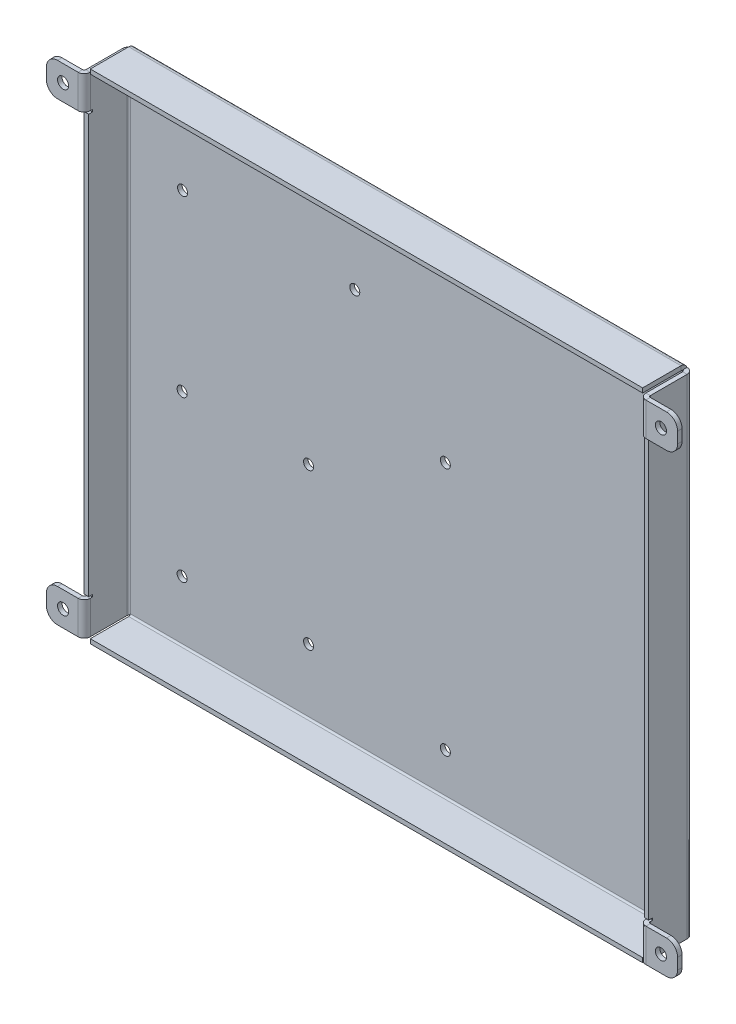
from build123d import *

# Parameters (mm, degrees)
SKETCH1_W                      = 250
SKETCH1_H                      = 220
BASE_FLANGE1_DEPTH             = 2
EDGE_FLANGE1_STRIP_W           = 9.4732
EDGE_FLANGE1_STRIP_H           = 2
EDGE_FLANGE1_STRIP_CUT_DEPTH   = 220
EDGE_FLANGE1_STRIP_2_W         = 9.4732
EDGE_FLANGE1_STRIP_2_H         = 2
EDGE_FLANGE1_STRIP_CUT_2_DEPTH = 220
EDGE_FLANGE1_DEPTH             = 220
EDGE_FLANGE1_BEND_DEPTH        = 220
EDGE_FLANGE2_STRIP_W           = 9.4732
EDGE_FLANGE2_STRIP_H           = 2
EDGE_FLANGE2_STRIP_CUT_DEPTH   = 248.5268
EDGE_FLANGE2_DEPTH             = 248.5268
EDGE_FLANGE3_STRIP_W           = 9.4732
EDGE_FLANGE3_STRIP_H           = 2
EDGE_FLANGE3_STRIP_CUT_DEPTH   = 248.5268
EDGE_FLANGE3_DEPTH             = 248.5268
EDGE_FLANGE4_STRIP_W           = 9.4732
EDGE_FLANGE4_STRIP_H           = 2
EDGE_FLANGE4_STRIP_CUT_DEPTH   = 15
EDGE_FLANGE4_RELIEF_W          = 10.4732
EDGE_FLANGE4_RELIEF_H          = 1
EDGE_FLANGE4_RELIEF_CUT_DEPTH  = 2
EDGE_FLANGE4_DEPTH             = 15
EDGE_FLANGE4_START             = 2
EDGE_FLANGE4_PROFILE_R         = 2.5
EDGE_FLANGE4_FLAT_DEPTH        = 2
EDGE_FLANGE5_STRIP_W           = 9.4732
EDGE_FLANGE5_STRIP_H           = 2
EDGE_FLANGE5_STRIP_CUT_DEPTH   = 15
EDGE_FLANGE5_RELIEF_W          = 10.4732
EDGE_FLANGE5_RELIEF_H          = 1
EDGE_FLANGE5_RELIEF_CUT_DEPTH  = 2
EDGE_FLANGE5_DEPTH             = 15
EDGE_FLANGE5_START             = 2
EDGE_FLANGE5_PROFILE_R         = 2.5
EDGE_FLANGE5_FLAT_DEPTH        = 2
EDGE_FLANGE7_STRIP_W           = 9.4732
EDGE_FLANGE7_STRIP_H           = 2
EDGE_FLANGE7_STRIP_CUT_DEPTH   = 15
EDGE_FLANGE7_RELIEF_W          = 10.4732
EDGE_FLANGE7_RELIEF_H          = 1
EDGE_FLANGE7_RELIEF_CUT_DEPTH  = 2
EDGE_FLANGE7_DEPTH             = 15
EDGE_FLANGE7_START             = 2
EDGE_FLANGE7_PROFILE_R         = 2.5
EDGE_FLANGE7_FLAT_DEPTH        = 2
EDGE_FLANGE8_STRIP_W           = 9.4732
EDGE_FLANGE8_STRIP_H           = 2
EDGE_FLANGE8_STRIP_CUT_DEPTH   = 15
EDGE_FLANGE8_RELIEF_W          = 10.4732
EDGE_FLANGE8_RELIEF_H          = 1
EDGE_FLANGE8_RELIEF_CUT_DEPTH  = 2
EDGE_FLANGE8_DEPTH             = 15
EDGE_FLANGE8_START             = 2
EDGE_FLANGE8_PROFILE_R         = 2.5
EDGE_FLANGE8_FLAT_DEPTH        = 2
SKETCH34_R                     = 2.25
CUT_EXTRUDE1_DEPTH             = 10
SKETCH35_R                     = 2.25
CUT_EXTRUDE2_DEPTH             = 10


# Sheet-metal steps are written as plain solids
with BuildPart() as part:
    # Sketch1 → Base-Flange1 (new body)
    with BuildSketch(Plane.XY):
        Rectangle(SKETCH1_W, SKETCH1_H)
    extrude(amount=-BASE_FLANGE1_DEPTH)

    # Edge-Flange1 strip (across the edge) → Edge-Flange1 strip cut (cut)
    with BuildSketch(Plane(origin=(125, -110, 0), x_dir=(-1, 0, 0), z_dir=(0, 1, 0))):
        with Locations((-4, -1)):
            Rectangle(EDGE_FLANGE1_STRIP_W, EDGE_FLANGE1_STRIP_H)
    extrude(amount=EDGE_FLANGE1_STRIP_CUT_DEPTH, mode=Mode.SUBTRACT)

    # Edge-Flange1 strip 2 (across the edge) → Edge-Flange1 strip cut 2 (cut)
    with BuildSketch(Plane(origin=(-125, 110, 0), x_dir=(1, 0, 0), z_dir=(0, -1, 0))):
        with Locations((-4, -1)):
            Rectangle(EDGE_FLANGE1_STRIP_2_W, EDGE_FLANGE1_STRIP_2_H)
    extrude(amount=EDGE_FLANGE1_STRIP_CUT_2_DEPTH, mode=Mode.SUBTRACT)

    # Edge-Flange1 section (across the edge) → Edge-Flange1 (add)
    with BuildSketch(Plane(origin=(125, -110, 0), x_dir=(-1, 0, 0), z_dir=(0, 1, 0))):
        with BuildLine():
            Line((-2, 0.7366), (-2, 18))
            Line((-2, 18), (0, 18))
            Line((0, 18), (0, 0.7366))
            ThreePointArc((0, 0.7366), (0.215745145, 0.215745145), (0.7366, 0))
            Line((0.7366, 0), (0.7366, -2))
            ThreePointArc((0.7366, -2), (-1.198468417, -1.198468417), (-2, 0.7366))
        make_face()
    extrude(amount=EDGE_FLANGE1_DEPTH)

    # Edge-Flange1 section 2 (across the edge) → Edge-Flange1 bend (add)
    with BuildSketch(Plane(origin=(-125, 110, 0), x_dir=(1, 0, 0), z_dir=(0, -1, 0))):
        with BuildLine():
            Line((-2, 0.7366), (-2, 18))
            Line((-2, 18), (0, 18))
            Line((0, 18), (0, 0.7366))
            ThreePointArc((0, 0.7366), (0.215745145, 0.215745145), (0.7366, 0))
            Line((0.7366, 0), (0.7366, -2))
            ThreePointArc((0.7366, -2), (-1.198468417, -1.198468417), (-2, 0.7366))
        make_face()
    extrude(amount=EDGE_FLANGE1_BEND_DEPTH)

    # Edge-Flange2 strip (across the edge) → Edge-Flange2 strip cut (cut)
    with BuildSketch(Plane(origin=(124.2634, 110, 0), x_dir=(0, -1, 0), z_dir=(-1, 0, 0))):
        with Locations((-4, -1)):
            Rectangle(EDGE_FLANGE2_STRIP_W, EDGE_FLANGE2_STRIP_H)
    extrude(amount=EDGE_FLANGE2_STRIP_CUT_DEPTH, mode=Mode.SUBTRACT)

    # Edge-Flange2 section (across the edge) → Edge-Flange2 (add)
    with BuildSketch(Plane(origin=(124.2634, 110, 0), x_dir=(0, -1, 0), z_dir=(-1, 0, 0))):
        with BuildLine():
            Line((-2, 0.7366), (-2, 18))
            Line((-2, 18), (0, 18))
            Line((0, 18), (0, 0.7366))
            ThreePointArc((0, 0.7366), (0.215745145, 0.215745145), (0.7366, 0))
            Line((0.7366, 0), (0.7366, -2))
            ThreePointArc((0.7366, -2), (-1.198468417, -1.198468417), (-2, 0.7366))
        make_face()
    extrude(amount=EDGE_FLANGE2_DEPTH)

    # Edge-Flange3 strip (across the edge) → Edge-Flange3 strip cut (cut)
    with BuildSketch(Plane(origin=(-124.2634, -110, 0), x_dir=(0, 1, 0), z_dir=(1, 0, 0))):
        with Locations((-4, -1)):
            Rectangle(EDGE_FLANGE3_STRIP_W, EDGE_FLANGE3_STRIP_H)
    extrude(amount=EDGE_FLANGE3_STRIP_CUT_DEPTH, mode=Mode.SUBTRACT)

    # Edge-Flange3 section (across the edge) → Edge-Flange3 (add)
    with BuildSketch(Plane(origin=(-124.2634, -110, 0), x_dir=(0, 1, 0), z_dir=(1, 0, 0))):
        with BuildLine():
            Line((-2, 0.7366), (-2, 18))
            Line((-2, 18), (0, 18))
            Line((0, 18), (0, 0.7366))
            ThreePointArc((0, 0.7366), (0.215745145, 0.215745145), (0.7366, 0))
            Line((0.7366, 0), (0.7366, -2))
            ThreePointArc((0.7366, -2), (-1.198468417, -1.198468417), (-2, 0.7366))
        make_face()
    extrude(amount=EDGE_FLANGE3_DEPTH)

    # Edge-Flange4 strip (across the edge) → Edge-Flange4 strip cut (cut)
    with BuildSketch(Plane(origin=(127, -95, 18), x_dir=(0, 0, -1), z_dir=(0, -1, 0))):
        with Locations((-4, -1)):
            Rectangle(EDGE_FLANGE4_STRIP_W, EDGE_FLANGE4_STRIP_H)
    extrude(amount=EDGE_FLANGE4_STRIP_CUT_DEPTH, mode=Mode.SUBTRACT)

    # Edge-Flange4 relief (on the sheet) → Edge-Flange4 relief cut (cut)
    with BuildSketch(Plane(origin=(127, -95, 17.2634), x_dir=(0, 0, -1), z_dir=(1, 0, 0))):
        with Locations((-4.2366, 0.5)):
            Rectangle(EDGE_FLANGE4_RELIEF_W, EDGE_FLANGE4_RELIEF_H)
    extrude(amount=-EDGE_FLANGE4_RELIEF_CUT_DEPTH, mode=Mode.SUBTRACT)

    # Edge-Flange4 bend section (across the edge) → Edge-Flange4 (add)
    with BuildSketch(Plane(origin=(127, -95, 18), x_dir=(0, 0, -1), z_dir=(0, -1, 0))):
        with BuildLine():
            Line((-2, 0.7366), (0, 0.7366))
            ThreePointArc((0, 0.7366), (0.215745145, 0.215745145), (0.7366, 0))
            Line((0.7366, 0), (0.7366, -2))
            ThreePointArc((0.7366, -2), (-1.198468417, -1.198468417), (-2, 0.7366))
        make_face()
    extrude(amount=EDGE_FLANGE4_DEPTH)

    # Edge-Flange4 profile (on flange) → Edge-Flange4 flat (add)
    with BuildSketch(Plane(origin=(127, 0, 18), x_dir=(0, -1, 0), z_dir=(0, 0, 1)).offset(EDGE_FLANGE4_START)):
        with BuildLine():
            Line((110, 0.7366), (110, 10))
            ThreePointArc((110, 10), (108.535533906, 13.535533906), (105, 15))
            Line((105, 15), (100, 15))
            ThreePointArc((100, 15), (96.464466094, 13.535533906), (95, 10))
            Line((95, 10), (95, 0.7366))
            Line((95, 0.7366), (110, 0.7366))
        make_face()
        with Locations((102.5, 7.5)):
            Circle(EDGE_FLANGE4_PROFILE_R, mode=Mode.SUBTRACT)
    extrude(amount=-EDGE_FLANGE4_FLAT_DEPTH)

    # Edge-Flange5 strip (across the edge) → Edge-Flange5 strip cut (cut)
    with BuildSketch(Plane(origin=(127, 110, 18), x_dir=(0, 0, -1), z_dir=(0, -1, 0))):
        with Locations((-4, -1)):
            Rectangle(EDGE_FLANGE5_STRIP_W, EDGE_FLANGE5_STRIP_H)
    extrude(amount=EDGE_FLANGE5_STRIP_CUT_DEPTH, mode=Mode.SUBTRACT)

    # Edge-Flange5 relief (on the sheet) → Edge-Flange5 relief cut (cut)
    with BuildSketch(Plane(origin=(127, 110, 17.2634), x_dir=(0, 0, -1), z_dir=(1, 0, 0))):
        with Locations((-4.2366, -15.5)):
            Rectangle(EDGE_FLANGE5_RELIEF_W, EDGE_FLANGE5_RELIEF_H)
    extrude(amount=-EDGE_FLANGE5_RELIEF_CUT_DEPTH, mode=Mode.SUBTRACT)

    # Edge-Flange5 bend section (across the edge) → Edge-Flange5 (add)
    with BuildSketch(Plane(origin=(127, 110, 18), x_dir=(0, 0, -1), z_dir=(0, -1, 0))):
        with BuildLine():
            Line((-2, 0.7366), (0, 0.7366))
            ThreePointArc((0, 0.7366), (0.215745145, 0.215745145), (0.7366, 0))
            Line((0.7366, 0), (0.7366, -2))
            ThreePointArc((0.7366, -2), (-1.198468417, -1.198468417), (-2, 0.7366))
        make_face()
    extrude(amount=EDGE_FLANGE5_DEPTH)

    # Edge-Flange5 profile (on flange) → Edge-Flange5 flat (add)
    with BuildSketch(Plane(origin=(127, 0, 18), x_dir=(0, -1, 0), z_dir=(0, 0, 1)).offset(EDGE_FLANGE5_START)):
        with BuildLine():
            Line((-110, 0.7366), (-95, 0.7366))
            Line((-95, 0.7366), (-95, 10))
            ThreePointArc((-95, 10), (-96.464466094, 13.535533906), (-100, 15))
            Line((-100, 15), (-105, 15))
            ThreePointArc((-105, 15), (-108.535533906, 13.535533906), (-110, 10))
            Line((-110, 10), (-110, 0.7366))
        make_face()
        with Locations((-102.5, 7.5)):
            Circle(EDGE_FLANGE5_PROFILE_R, mode=Mode.SUBTRACT)
    extrude(amount=-EDGE_FLANGE5_FLAT_DEPTH)

    # Edge-Flange7 strip (across the edge) → Edge-Flange7 strip cut (cut)
    with BuildSketch(Plane(origin=(-127, -110, 18), x_dir=(0, 0, -1), z_dir=(0, 1, 0))):
        with Locations((-4, -1)):
            Rectangle(EDGE_FLANGE7_STRIP_W, EDGE_FLANGE7_STRIP_H)
    extrude(amount=EDGE_FLANGE7_STRIP_CUT_DEPTH, mode=Mode.SUBTRACT)

    # Edge-Flange7 relief (on the sheet) → Edge-Flange7 relief cut (cut)
    with BuildSketch(Plane(origin=(-127, -110, 17.2634), x_dir=(0, 0, -1), z_dir=(-1, 0, 0))):
        with Locations((-4.2366, -15.5)):
            Rectangle(EDGE_FLANGE7_RELIEF_W, EDGE_FLANGE7_RELIEF_H)
    extrude(amount=-EDGE_FLANGE7_RELIEF_CUT_DEPTH, mode=Mode.SUBTRACT)

    # Edge-Flange7 bend section (across the edge) → Edge-Flange7 (add)
    with BuildSketch(Plane(origin=(-127, -110, 18), x_dir=(0, 0, -1), z_dir=(0, 1, 0))):
        with BuildLine():
            Line((-2, 0.7366), (0, 0.7366))
            ThreePointArc((0, 0.7366), (0.215745145, 0.215745145), (0.7366, 0))
            Line((0.7366, 0), (0.7366, -2))
            ThreePointArc((0.7366, -2), (-1.198468417, -1.198468417), (-2, 0.7366))
        make_face()
    extrude(amount=EDGE_FLANGE7_DEPTH)

    # Edge-Flange7 profile (on flange) → Edge-Flange7 flat (add)
    with BuildSketch(Plane(origin=(-127, 0, 18), x_dir=(0, 1, 0), z_dir=(0, 0, 1)).offset(EDGE_FLANGE7_START)):
        with BuildLine():
            Line((-95, 0.7366), (-95, 10))
            ThreePointArc((-95, 10), (-96.464466094, 13.535533906), (-100, 15))
            Line((-100, 15), (-105, 15))
            ThreePointArc((-105, 15), (-108.535533906, 13.535533906), (-110, 10))
            Line((-110, 10), (-110, 0.7366))
            Line((-110, 0.7366), (-95, 0.7366))
        make_face()
        with Locations((-102.5, 7.5)):
            Circle(EDGE_FLANGE7_PROFILE_R, mode=Mode.SUBTRACT)
    extrude(amount=-EDGE_FLANGE7_FLAT_DEPTH)

    # Edge-Flange8 strip (across the edge) → Edge-Flange8 strip cut (cut)
    with BuildSketch(Plane(origin=(-127, 95, 18), x_dir=(0, 0, -1), z_dir=(0, 1, 0))):
        with Locations((-4, -1)):
            Rectangle(EDGE_FLANGE8_STRIP_W, EDGE_FLANGE8_STRIP_H)
    extrude(amount=EDGE_FLANGE8_STRIP_CUT_DEPTH, mode=Mode.SUBTRACT)

    # Edge-Flange8 relief (on the sheet) → Edge-Flange8 relief cut (cut)
    with BuildSketch(Plane(origin=(-127, 95, 17.2634), x_dir=(0, 0, -1), z_dir=(-1, 0, 0))):
        with Locations((-4.2366, 0.5)):
            Rectangle(EDGE_FLANGE8_RELIEF_W, EDGE_FLANGE8_RELIEF_H)
    extrude(amount=-EDGE_FLANGE8_RELIEF_CUT_DEPTH, mode=Mode.SUBTRACT)

    # Edge-Flange8 bend section (across the edge) → Edge-Flange8 (add)
    with BuildSketch(Plane(origin=(-127, 95, 18), x_dir=(0, 0, -1), z_dir=(0, 1, 0))):
        with BuildLine():
            Line((-2, 0.7366), (0, 0.7366))
            ThreePointArc((0, 0.7366), (0.215745145, 0.215745145), (0.7366, 0))
            Line((0.7366, 0), (0.7366, -2))
            ThreePointArc((0.7366, -2), (-1.198468417, -1.198468417), (-2, 0.7366))
        make_face()
    extrude(amount=EDGE_FLANGE8_DEPTH)

    # Edge-Flange8 profile (on flange) → Edge-Flange8 flat (add)
    with BuildSketch(Plane(origin=(-127, 0, 18), x_dir=(0, 1, 0), z_dir=(0, 0, 1)).offset(EDGE_FLANGE8_START)):
        with BuildLine():
            Line((95, 0.7366), (110, 0.7366))
            Line((110, 0.7366), (110, 10))
            ThreePointArc((110, 10), (108.535533906, 13.535533906), (105, 15))
            Line((105, 15), (100, 15))
            ThreePointArc((100, 15), (96.464466094, 13.535533906), (95, 10))
            Line((95, 10), (95, 0.7366))
        make_face()
        with Locations((102.5, 7.5)):
            Circle(EDGE_FLANGE8_PROFILE_R, mode=Mode.SUBTRACT)
    extrude(amount=-EDGE_FLANGE8_FLAT_DEPTH)

    # Sketch34 → Cut-Extrude1 (cut)
    with BuildSketch(Plane.XY):
        with Locations((-44.05, -11)):
            Circle(SKETCH34_R)
        with Locations((-44.05, -80.957948311)):
            Circle(SKETCH34_R)
        with Locations((-100.95, -83)):
            Circle(SKETCH34_R)
        with Locations((-100.95, -11)):
            Circle(SKETCH34_R)
    extrude(amount=-CUT_EXTRUDE1_DEPTH, mode=Mode.SUBTRACT)

    # Sketch35 → Cut-Extrude2 (cut)
    with BuildSketch(Plane(origin=(0, 0, -2), x_dir=(-1, 0, 0), z_dir=(0, 0, -1))):
        with Locations((100.75, 67.5)):
            Circle(SKETCH35_R)
        with Locations((23.25, 67.5)):
            Circle(SKETCH35_R)
        with Locations((-110, 90.5)):
            Circle(SKETCH35_R)
        with Locations((-17.5, 20.5)):
            Circle(SKETCH35_R)
        with Locations((-110, -21.5)):
            Circle(SKETCH35_R)
        with Locations((-17.5, -91.5)):
            Circle(SKETCH35_R)
    extrude(amount=-CUT_EXTRUDE2_DEPTH, mode=Mode.SUBTRACT)


solid = part.part
